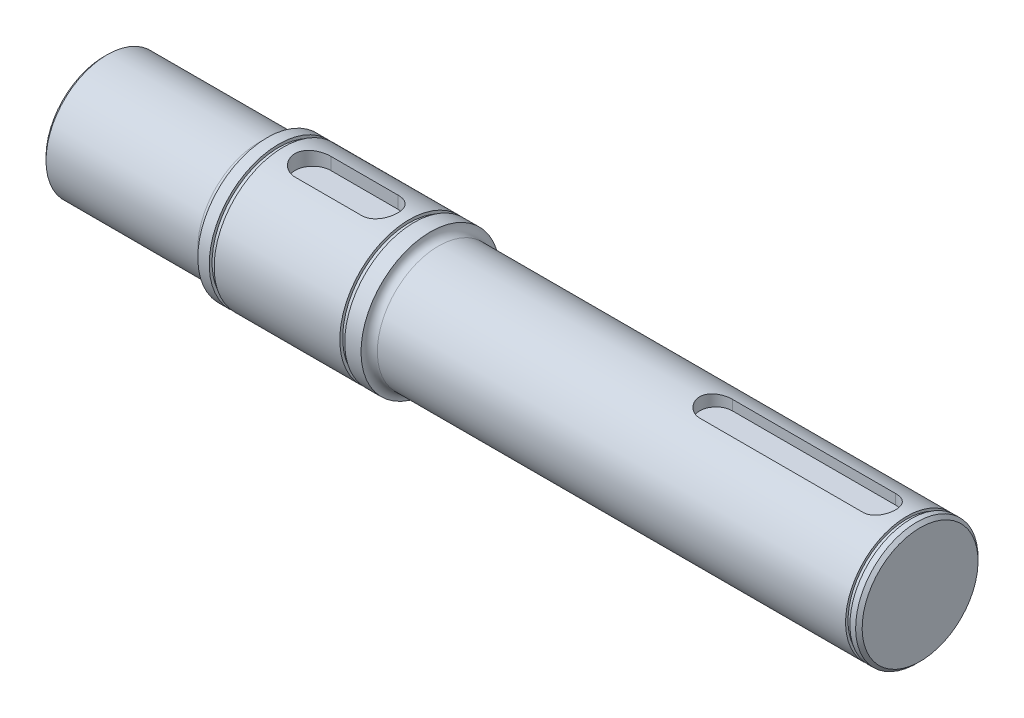
from build123d import *

# Parameters (mm, degrees)
ESQUISSE2_R             = 42.5
ESQUISSE2_R_2           = 40.75
ENL_V_MAT_EXTRU_1_DEPTH = 3
ESQUISSE3_R             = 42.5
ESQUISSE3_R_2           = 40.75
ENL_V_MAT_EXTRU_2_DEPTH = 3
ENL_V_MAT_EXTRU_3_DEPTH = 9
ENL_V_MAT_EXTRU_4_DEPTH = 7.5
CHANFREIN1_SIZE         = 2
ESQUISSE6_R             = 37.5
ESQUISSE6_R_2           = 36
ENL_V_MAT_EXTRU_5_DEPTH = 2.65


with BuildPart() as part:
    # Esquisse1 → Révolution1 (revolve)
    with BuildSketch(Plane.XY):
        with BuildLine():
            Line((0, 0), (0, 37.5))
            Line((0, 37.5), (95, 37.5))
            ThreePointArc((95, 37.5), (98.535533906, 38.964466094), (100, 42.5))
            Line((100, 42.5), (200, 42.5))
            ThreePointArc((200, 42.5), (201.464466094, 38.964466094), (205, 37.5))
            Line((205, 37.5), (500, 37.5))
            Line((500, 37.5), (500, 0))
            Line((500, 0), (0, 0))
        make_face()
    revolve(axis=Axis((500, 0, 0), (-1, 0, 0)))

    # Esquisse2 → Enlèv. mat.-Extru.1 (cut)
    with BuildSketch(Plane(origin=(110, 0, 0), x_dir=(0, 0, -1), z_dir=(1, 0, 0))):
        Circle(ESQUISSE2_R)
        Circle(ESQUISSE2_R_2, mode=Mode.SUBTRACT)
    extrude(amount=-ENL_V_MAT_EXTRU_1_DEPTH, mode=Mode.SUBTRACT)

    # Esquisse3 → Enlèv. mat.-Extru.2 (cut)
    with BuildSketch(Plane(origin=(190, 0, 0), x_dir=(0, 0, -1), z_dir=(1, 0, 0))):
        Circle(ESQUISSE3_R)
        Circle(ESQUISSE3_R_2, mode=Mode.SUBTRACT)
    extrude(amount=-ENL_V_MAT_EXTRU_2_DEPTH, mode=Mode.SUBTRACT)

    # Esquisse4 → Enlèv. mat.-Extru.3 (cut)
    with BuildSketch(Plane(origin=(0, 42.5, 0), x_dir=(1, 0, 0), z_dir=(0, 1, 0))):
        with BuildLine():
            Line((128, 11), (169, 11))
            ThreePointArc((169, 11), (180, 0), (169, -11))
            Line((169, -11), (128, -11))
            ThreePointArc((128, -11), (117, 0), (128, 11))
        make_face()
    extrude(amount=-ENL_V_MAT_EXTRU_3_DEPTH, mode=Mode.SUBTRACT)

    # Esquisse5 → Enlèv. mat.-Extru.4 (cut)
    with BuildSketch(Plane(origin=(0, 37.5, 0), x_dir=(1, 0, 0), z_dir=(0, 1, 0))):
        with BuildLine():
            Line((475, -10), (375, -10))
            ThreePointArc((375, -10), (365, 0), (375, 10))
            Line((375, 10), (475, 10))
            ThreePointArc((475, 10), (485, 0), (475, -10))
        make_face()
    extrude(amount=-ENL_V_MAT_EXTRU_4_DEPTH, mode=Mode.SUBTRACT)

    # Chanfrein1
    chanfrein1_edges = [part.edges().sort_by_distance(p)[0] for p in [
        (500, -37.5, 0),
        (0, -37.5, 0),
    ]]
    chamfer(chanfrein1_edges, length=CHANFREIN1_SIZE)

    # Esquisse6 → Enlèv. mat.-Extru.5 (cut)
    with BuildSketch(Plane(origin=(494.5, 0, 0), x_dir=(0, 0, -1), z_dir=(1, 0, 0))):
        Circle(ESQUISSE6_R)
        Circle(ESQUISSE6_R_2, mode=Mode.SUBTRACT)
    extrude(amount=-ENL_V_MAT_EXTRU_5_DEPTH, mode=Mode.SUBTRACT)


solid = part.part
